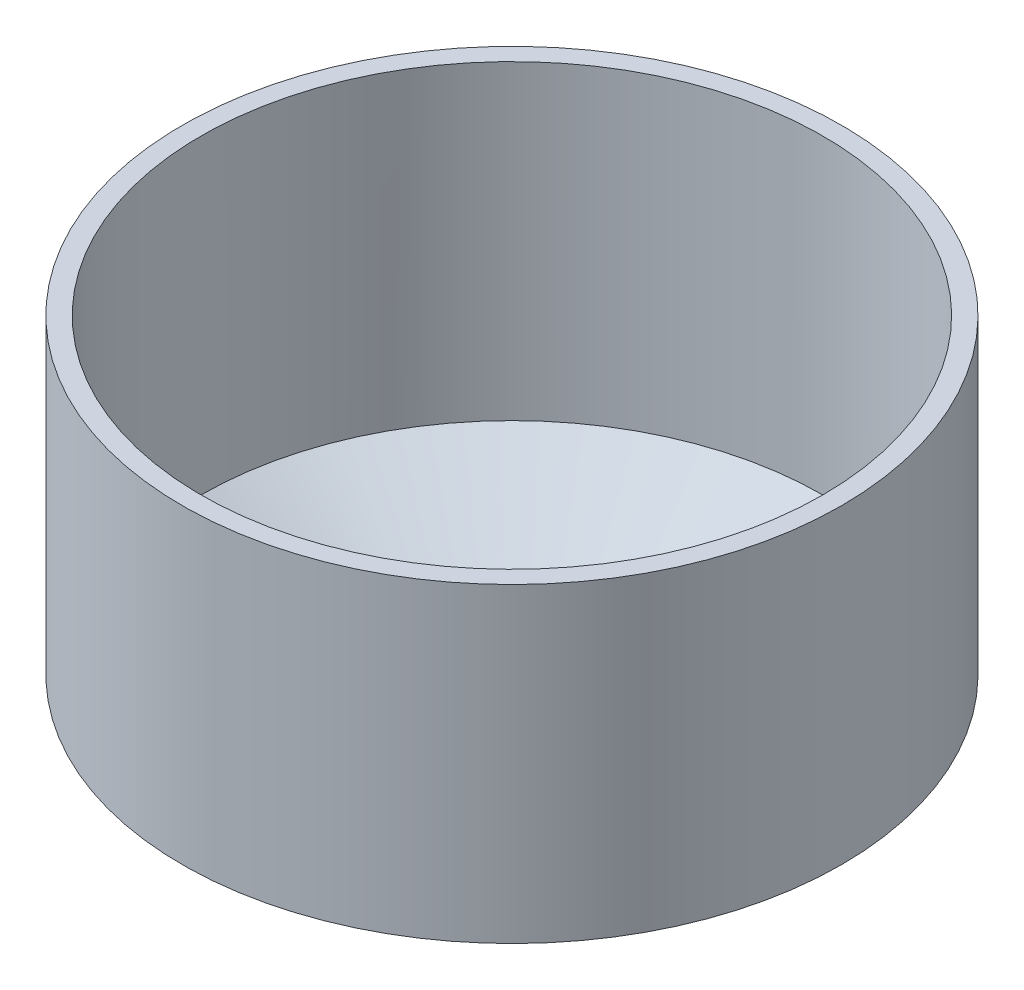
from build123d import *


with BuildPart() as part:
    # Sketch2 → Revolve2 (revolve)
    with BuildSketch(Plane.XY):
        Polygon((21.2, 20), (21.2, 0), (7.85, -8.243397358), (6.65, -8.243397358), (20, 0), (20, 20), align=None)
    revolve(axis=Axis((0, -1000, 0), (0, 1, 0)))


solid = part.part
